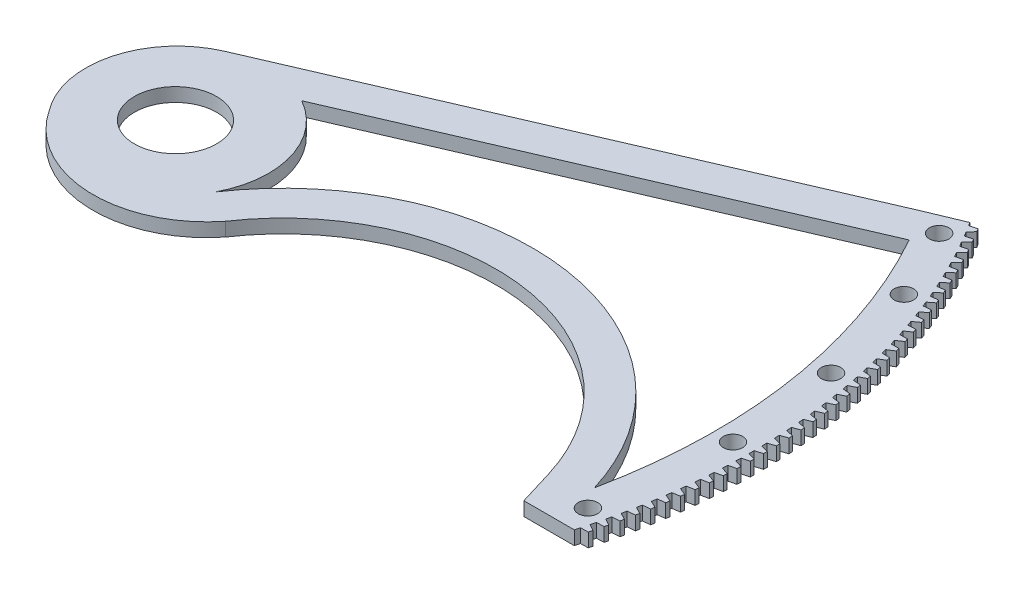
from build123d import *

# Parameters (mm, degrees)
SKETCH1_R                 = 3.3782
SKETCH1_R_2               = 14.28115
SKETCH1_R_3               = 2.5527
SKETCH1_R_4               = 9.5885
SKETCH1_R_5               = 19.177
SKETCH1_R_6               = 4.1275
BOSS_EXTRUDE1_DEPTH       = 4.7625
SKETCH2_R                 = 19.177
SKETCH2_R_2               = 2.5527
SKETCH2_R_3               = 4.1275
SKETCH2_R_4               = 9.5885
BOSS_EXTRUDE2_DEPTH       = 4.7625
CUT_EXTRUDE1_DEPTH        = 337.793278817
BOSS_EXTRUDE3_DEPTH       = 4.7625
BOSS_EXTRUDE4_DEPTH       = 4.7625
CUT_EXTRUDE3_DEPTH        = 262.784443921
BOSS_EXTRUDE6_START       = -4.7625
BOSS_EXTRUDE6_OUTLINE_R   = 3.3782
BOSS_EXTRUDE6_OUTLINE_R_2 = 2.5527
BOSS_EXTRUDE6_DEPTH       = 4.7625
SKETCH8_R                 = 3.3782
CUT_EXTRUDE4_DEPTH        = 4.7625


# Read off the part's stored shape, not the designer's step: Boss-Extrude6
with BuildPart() as part:
    # Sketch1 → Boss-Extrude1 (new body)
    with BuildSketch(Plane.XZ):
        with BuildLine():
            Line((231.775, 53.975), (-37.026544532, 53.975))
            ThreePointArc((-37.026544532, 53.975), (-39.086756581, 53.631498674), (-40.924075536, 52.638157895))
            ThreePointArc((-40.924075536, 52.638157895), (-66.304119268, -7.022776738), (-28.989130435, -60.043200628))
            ThreePointArc((-28.989130435, -60.043200628), (-26.371616333, -62.385880153), (-25.4, -65.761600688))
            Line((-25.4, -65.761600688), (-25.4, -230.990796624))
            ThreePointArc((-25.4, -230.990796624), (-23.721010495, -235.292442932), (-19.571917808, -237.3193116))
            ThreePointArc((-19.571917808, -237.3193116), (161.311736549, -175.162893549), (238.125, 0))
            Line((238.125, 0), (238.125, 47.625))
            ThreePointArc((238.125, 47.625), (236.265128061, 52.115128061), (231.775, 53.975))
        make_face()
        with Locations(Location((-60.325, 0, 0), (0, 0, 270))):
            Circle(SKETCH1_R, mode=Mode.SUBTRACT)
        with Locations(Location((-42.656216575, 42.656216575, 0), (0, 0, 270))):
            Circle(SKETCH1_R, mode=Mode.SUBTRACT)
        with Locations(Location((-42.656216575, -42.656216575, 0), (0, 0, 270))):
            Circle(SKETCH1_R, mode=Mode.SUBTRACT)
        with Locations(Location((0, -155.575, 0), (0, 0, 270))):
            Circle(SKETCH1_R, mode=Mode.SUBTRACT)
        with Locations(Location((0, -168.275, 0), (0, 0, 270))):
            Circle(SKETCH1_R, mode=Mode.SUBTRACT)
        with Locations(Location((0, -180.975, 0), (0, 0, 270))):
            Circle(SKETCH1_R, mode=Mode.SUBTRACT)
        with Locations(Location((0, -193.675, 0), (0, 0, 270))):
            Circle(SKETCH1_R, mode=Mode.SUBTRACT)
        with Locations(Location((0, -206.375, 0), (0, 0, 270))):
            Circle(SKETCH1_R, mode=Mode.SUBTRACT)
        with Locations(Location((0, -219.075, 0), (0, 0, 270))):
            Circle(SKETCH1_R, mode=Mode.SUBTRACT)
        with Locations(Location((59.53597499, -143.73255827, 0), (0, 0, 270))):
            Circle(SKETCH1_R, mode=Mode.SUBTRACT)
        with Locations(Location((64.396054581, -155.465828333, 0), (0, 0, 270))):
            Circle(SKETCH1_R, mode=Mode.SUBTRACT)
        with Locations(Location((69.256134172, -167.199098396, 0), (0, 0, 270))):
            Circle(SKETCH1_R, mode=Mode.SUBTRACT)
        with Locations(Location((74.116213763, -178.932368459, 0), (0, 0, 270))):
            Circle(SKETCH1_R, mode=Mode.SUBTRACT)
        with Locations(Location((78.976293354, -190.665638522, 0), (0, 0, 270))):
            Circle(SKETCH1_R, mode=Mode.SUBTRACT)
        with Locations(Location((83.836372945, -202.398908585, 0), (0, 0, 270))):
            Circle(SKETCH1_R, mode=Mode.SUBTRACT)
        with Locations(Location((110.008137483, -110.008137483, 0), (0, 0, 270))):
            Circle(SKETCH1_R, mode=Mode.SUBTRACT)
        with Locations(Location((118.988393604, -118.988393604, 0), (0, 0, 270))):
            Circle(SKETCH1_R, mode=Mode.SUBTRACT)
        with Locations(Location((127.968649725, -127.968649725, 0), (0, 0, 270))):
            Circle(SKETCH1_R, mode=Mode.SUBTRACT)
        with Locations(Location((136.948905846, -136.948905846, 0), (0, 0, 270))):
            Circle(SKETCH1_R, mode=Mode.SUBTRACT)
        with Locations(Location((145.929161967, -145.929161967, 0), (0, 0, 270))):
            Circle(SKETCH1_R, mode=Mode.SUBTRACT)
        with Locations(Location((154.909418088, -154.909418088, 0), (0, 0, 270))):
            Circle(SKETCH1_R, mode=Mode.SUBTRACT)
        with Locations(Location((143.73255827, -59.53597499, 0), (0, 0, 270))):
            Circle(SKETCH1_R, mode=Mode.SUBTRACT)
        with Locations(Location((155.465828333, -64.396054581, 0), (0, 0, 270))):
            Circle(SKETCH1_R, mode=Mode.SUBTRACT)
        with Locations(Location((167.199098396, -69.256134172, 0), (0, 0, 270))):
            Circle(SKETCH1_R, mode=Mode.SUBTRACT)
        with Locations(Location((178.932368459, -74.116213763, 0), (0, 0, 270))):
            Circle(SKETCH1_R, mode=Mode.SUBTRACT)
        with Locations(Location((190.665638522, -78.976293354, 0), (0, 0, 270))):
            Circle(SKETCH1_R, mode=Mode.SUBTRACT)
        with Locations(Location((202.398908585, -83.836372945, 0), (0, 0, 270))):
            Circle(SKETCH1_R, mode=Mode.SUBTRACT)
        with Locations(Location((155.575, 0, 0), (0, 0, 270))):
            Circle(SKETCH1_R, mode=Mode.SUBTRACT)
        with Locations(Location((168.275, 0, 0), (0, 0, 270))):
            Circle(SKETCH1_R, mode=Mode.SUBTRACT)
        with Locations(Location((180.975, 0, 0), (0, 0, 270))):
            Circle(SKETCH1_R, mode=Mode.SUBTRACT)
        with Locations(Location((193.675, 0, 0), (0, 0, 270))):
            Circle(SKETCH1_R, mode=Mode.SUBTRACT)
        with Locations(Location((206.375, 0, 0), (0, 0, 270))):
            Circle(SKETCH1_R, mode=Mode.SUBTRACT)
        with Locations(Location((219.075, 0, 0), (0, 0, 270))):
            Circle(SKETCH1_R, mode=Mode.SUBTRACT)
        with Locations(Location((0, 0, 0), (0, 0, 270))):
            Circle(SKETCH1_R_2, mode=Mode.SUBTRACT)
        with Locations(Location((148.683592319, 12.7, 0), (0, 0, 270))):
            Circle(SKETCH1_R, mode=Mode.SUBTRACT)
        with Locations(Location((141.086323741, -159.046835983, 0), (0, 0, 270))):
            Circle(SKETCH1_R, mode=Mode.SUBTRACT)
        with Locations(Location((150.036456986, -132.075944743, 0), (0, 0, 270))):
            Circle(SKETCH1_R, mode=Mode.SUBTRACT)
        with Locations(Location((150.066579862, -168.027092104, 0), (0, 0, 270))):
            Circle(SKETCH1_R, mode=Mode.SUBTRACT)
        with Locations(Location((159.016713107, -141.056200864, 0), (0, 0, 270))):
            Circle(SKETCH1_R, mode=Mode.SUBTRACT)
        with Locations(Location((-12.7, -186.8261925, 0), (0, 0, 270))):
            Circle(SKETCH1_R, mode=Mode.SUBTRACT)
        with Locations(Location((12.7, -174.083592319, 0), (0, 0, 270))):
            Circle(SKETCH1_R, mode=Mode.SUBTRACT)
        with Locations(Location((-12.7, -199.5261925, 0), (0, 0, 270))):
            Circle(SKETCH1_R, mode=Mode.SUBTRACT)
        with Locations(Location((12.7, -186.783592319, 0), (0, 0, 270))):
            Circle(SKETCH1_R, mode=Mode.SUBTRACT)
        with Locations(Location((-12.7, -212.2261925, 0), (0, 0, 270))):
            Circle(SKETCH1_R, mode=Mode.SUBTRACT)
        with Locations(Location((12.7, -199.483592319, 0), (0, 0, 270))):
            Circle(SKETCH1_R, mode=Mode.SUBTRACT)
        with Locations(Location((-12.7, -224.9261925, 0), (0, 0, 270))):
            Circle(SKETCH1_R, mode=Mode.SUBTRACT)
        with Locations(Location((12.7, -212.183592319, 0), (0, 0, 270))):
            Circle(SKETCH1_R, mode=Mode.SUBTRACT)
        with Locations(Location((69.482177721, -200.931515104, 0), (0, 0, 270))):
            Circle(SKETCH1_R, mode=Mode.SUBTRACT)
        with Locations(Location((88.072335872, -179.438728425, 0), (0, 0, 270))):
            Circle(SKETCH1_R, mode=Mode.SUBTRACT)
        with Locations(Location((74.342257312, -212.664785167, 0), (0, 0, 270))):
            Circle(SKETCH1_R, mode=Mode.SUBTRACT)
        with Locations(Location((92.932415463, -191.171998488, 0), (0, 0, 270))):
            Circle(SKETCH1_R, mode=Mode.SUBTRACT)
        with Locations(Location((50.041859357, -153.998434853, 0), (0, 0, 270))):
            Circle(SKETCH1_R, mode=Mode.SUBTRACT)
        with Locations(Location((68.632017508, -132.505648173, 0), (0, 0, 270))):
            Circle(SKETCH1_R, mode=Mode.SUBTRACT)
        with Locations(Location((54.901938948, -165.731704916, 0), (0, 0, 270))):
            Circle(SKETCH1_R, mode=Mode.SUBTRACT)
        with Locations(Location((73.492097099, -144.238918236, 0), (0, 0, 270))):
            Circle(SKETCH1_R, mode=Mode.SUBTRACT)
        with Locations(Location((59.762018539, -177.464974979, 0), (0, 0, 270))):
            Circle(SKETCH1_R, mode=Mode.SUBTRACT)
        with Locations(Location((78.35217669, -155.972188299, 0), (0, 0, 270))):
            Circle(SKETCH1_R, mode=Mode.SUBTRACT)
        with Locations(Location((64.62209813, -189.198245042, 0), (0, 0, 270))):
            Circle(SKETCH1_R, mode=Mode.SUBTRACT)
        with Locations(Location((83.212256281, -167.705458362, 0), (0, 0, 270))):
            Circle(SKETCH1_R, mode=Mode.SUBTRACT)
        with Locations(Location((123.125811499, -141.086323741, 0), (0, 0, 270))):
            Circle(SKETCH1_R, mode=Mode.SUBTRACT)
        with Locations(Location((132.075944743, -114.115432501, 0), (0, 0, 270))):
            Circle(SKETCH1_R, mode=Mode.SUBTRACT)
        with Locations(Location((132.10606762, -150.066579862, 0), (0, 0, 270))):
            Circle(SKETCH1_R, mode=Mode.SUBTRACT)
        with Locations(Location((141.056200864, -123.095688622, 0), (0, 0, 270))):
            Circle(SKETCH1_R, mode=Mode.SUBTRACT)
        with Locations(Location((200.89215767, -69.465875337, 0), (0, 0, 270))):
            Circle(SKETCH1_R, mode=Mode.SUBTRACT)
        with Locations(Location((202.944625985, -97.808797438, 0), (0, 0, 270))):
            Circle(SKETCH1_R, mode=Mode.SUBTRACT)
        with Locations(Location((189.158887607, -64.605795746, 0), (0, 0, 270))):
            Circle(SKETCH1_R, mode=Mode.SUBTRACT)
        with Locations(Location((191.211355922, -92.948717847, 0), (0, 0, 270))):
            Circle(SKETCH1_R, mode=Mode.SUBTRACT)
        with Locations(Location((105.165299257, -123.125811499, 0), (0, 0, 270))):
            Circle(SKETCH1_R, mode=Mode.SUBTRACT)
        with Locations(Location((114.115432501, -96.154920259, 0), (0, 0, 270))):
            Circle(SKETCH1_R, mode=Mode.SUBTRACT)
        with Locations(Location((114.145555378, -132.10606762, 0), (0, 0, 270))):
            Circle(SKETCH1_R, mode=Mode.SUBTRACT)
        with Locations(Location((123.095688622, -105.13517638, 0), (0, 0, 270))):
            Circle(SKETCH1_R, mode=Mode.SUBTRACT)
        with Locations(Location((153.959077418, -50.025556973, 0), (0, 0, 270))):
            Circle(SKETCH1_R, mode=Mode.SUBTRACT)
        with Locations(Location((156.011545734, -78.368479073, 0), (0, 0, 270))):
            Circle(SKETCH1_R, mode=Mode.SUBTRACT)
        with Locations(Location((142.225807355, -45.165477382, 0), (0, 0, 270))):
            Circle(SKETCH1_R, mode=Mode.SUBTRACT)
        with Locations(Location((144.278275671, -73.508399482, 0), (0, 0, 270))):
            Circle(SKETCH1_R, mode=Mode.SUBTRACT)
        with Locations(Location((177.425617544, -59.745716155, 0), (0, 0, 270))):
            Circle(SKETCH1_R, mode=Mode.SUBTRACT)
        with Locations(Location((179.478085859, -88.088638255, 0), (0, 0, 270))):
            Circle(SKETCH1_R, mode=Mode.SUBTRACT)
        with Locations(Location((165.692347481, -54.885636564, 0), (0, 0, 270))):
            Circle(SKETCH1_R, mode=Mode.SUBTRACT)
        with Locations(Location((167.744815797, -83.228558664, 0), (0, 0, 270))):
            Circle(SKETCH1_R, mode=Mode.SUBTRACT)
        with Locations(Location((-12.7, -161.4261925, 0), (0, 0, 270))):
            Circle(SKETCH1_R, mode=Mode.SUBTRACT)
        with Locations(Location((12.7, -148.683592319, 0), (0, 0, 270))):
            Circle(SKETCH1_R, mode=Mode.SUBTRACT)
        with Locations(Location((-12.7, -174.1261925, 0), (0, 0, 270))):
            Circle(SKETCH1_R, mode=Mode.SUBTRACT)
        with Locations(Location((12.7, -161.383592319, 0), (0, 0, 270))):
            Circle(SKETCH1_R, mode=Mode.SUBTRACT)
        with Locations(Location((186.8261925, -12.7, 0), (0, 0, 270))):
            Circle(SKETCH1_R, mode=Mode.SUBTRACT)
        with Locations(Location((174.083592319, 12.7, 0), (0, 0, 270))):
            Circle(SKETCH1_R, mode=Mode.SUBTRACT)
        with Locations(Location((199.5261925, -12.7, 0), (0, 0, 270))):
            Circle(SKETCH1_R, mode=Mode.SUBTRACT)
        with Locations(Location((186.783592319, 12.7, 0), (0, 0, 270))):
            Circle(SKETCH1_R, mode=Mode.SUBTRACT)
        with Locations(Location((212.2261925, -12.7, 0), (0, 0, 270))):
            Circle(SKETCH1_R, mode=Mode.SUBTRACT)
        with Locations(Location((199.483592319, 12.7, 0), (0, 0, 270))):
            Circle(SKETCH1_R, mode=Mode.SUBTRACT)
        with Locations(Location((224.9261925, -12.7, 0), (0, 0, 270))):
            Circle(SKETCH1_R, mode=Mode.SUBTRACT)
        with Locations(Location((212.183592319, 12.7, 0), (0, 0, 270))):
            Circle(SKETCH1_R, mode=Mode.SUBTRACT)
        with Locations(Location((161.4261925, -12.7, 0), (0, 0, 270))):
            Circle(SKETCH1_R, mode=Mode.SUBTRACT)
        with Locations(Location((174.1261925, -12.7, 0), (0, 0, 270))):
            Circle(SKETCH1_R, mode=Mode.SUBTRACT)
        with Locations(Location((161.383592319, 12.7, 0), (0, 0, 270))):
            Circle(SKETCH1_R, mode=Mode.SUBTRACT)
        with Locations(Location((225.425, 41.275, 0), (0, 0, 270))):
            Circle(SKETCH1_R_3, mode=Mode.SUBTRACT)
        with Locations(Location((212.725, 41.275, 0), (0, 0, 270))):
            Circle(SKETCH1_R_3, mode=Mode.SUBTRACT)
        with Locations(Location((200.025, 41.275, 0), (0, 0, 270))):
            Circle(SKETCH1_R_3, mode=Mode.SUBTRACT)
        with Locations(Location((187.325, 41.275, 0), (0, 0, 270))):
            Circle(SKETCH1_R_3, mode=Mode.SUBTRACT)
        with Locations(Location((174.625, 41.275, 0), (0, 0, 270))):
            Circle(SKETCH1_R_3, mode=Mode.SUBTRACT)
        with Locations(Location((161.925, 41.275, 0), (0, 0, 270))):
            Circle(SKETCH1_R_3, mode=Mode.SUBTRACT)
        with Locations(Location((149.225, 41.275, 0), (0, 0, 270))):
            Circle(SKETCH1_R_3, mode=Mode.SUBTRACT)
        with Locations(Location((136.525, 41.275, 0), (0, 0, 270))):
            Circle(SKETCH1_R_3, mode=Mode.SUBTRACT)
        with Locations(Location((123.825, 41.275, 0), (0, 0, 270))):
            Circle(SKETCH1_R_3, mode=Mode.SUBTRACT)
        with Locations(Location((111.125, 41.275, 0), (0, 0, 270))):
            Circle(SKETCH1_R_3, mode=Mode.SUBTRACT)
        with Locations(Location((98.425, 41.275, 0), (0, 0, 270))):
            Circle(SKETCH1_R_3, mode=Mode.SUBTRACT)
        with Locations(Location((73.025, 41.275, 0), (0, 0, 270))):
            Circle(SKETCH1_R_3, mode=Mode.SUBTRACT)
        with Locations(Location((85.725, 41.275, 0), (0, 0, 270))):
            Circle(SKETCH1_R_3, mode=Mode.SUBTRACT)
        with Locations(Location((60.325, 41.275, 0), (0, 0, 270))):
            Circle(SKETCH1_R_3, mode=Mode.SUBTRACT)
        with Locations(Location((47.625, 41.275, 0), (0, 0, 270))):
            Circle(SKETCH1_R_3, mode=Mode.SUBTRACT)
        with Locations(Location((34.925, 41.275, 0), (0, 0, 270))):
            Circle(SKETCH1_R_3, mode=Mode.SUBTRACT)
        with Locations(Location((22.225, 41.275, 0), (0, 0, 270))):
            Circle(SKETCH1_R_3, mode=Mode.SUBTRACT)
        with Locations(Location((9.525, 41.275, 0), (0, 0, 270))):
            Circle(SKETCH1_R_3, mode=Mode.SUBTRACT)
        with Locations(Location((-3.175, 41.275, 0), (0, 0, 270))):
            Circle(SKETCH1_R_3, mode=Mode.SUBTRACT)
        with Locations(Location((-15.875, 41.275, 0), (0, 0, 270))):
            Circle(SKETCH1_R_3, mode=Mode.SUBTRACT)
        with Locations(Location((-17.960512242, 17.960512242, 0), (0, 0, 270))):
            Circle(SKETCH1_R_3, mode=Mode.SUBTRACT)
        with Locations(Location((-17.960512242, -17.960512242, 0), (0, 0, 270))):
            Circle(SKETCH1_R_3, mode=Mode.SUBTRACT)
        with Locations(Location((17.960512242, -17.960512242, 0), (0, 0, 270))):
            Circle(SKETCH1_R_3, mode=Mode.SUBTRACT)
        with Locations(Location((17.960512242, 17.960512242, 0), (0, 0, 270))):
            Circle(SKETCH1_R_3, mode=Mode.SUBTRACT)
        with Locations(Location((52.114561305, -6.35, 0), (0, 0, 270))):
            Circle(SKETCH1_R_4, mode=Mode.SUBTRACT)
        with Locations(Location((70.075073547, 11.610512242, 0), (0, 0, 270))):
            Circle(SKETCH1_R_3, mode=Mode.SUBTRACT)
        with Locations(Location((-17.960512242, -34.539487758, 0), (0, 0, 270))):
            Circle(SKETCH1_R_3, mode=Mode.SUBTRACT)
        with Locations(Location((17.960512242, -70.460512242, 0), (0, 0, 270))):
            Circle(SKETCH1_R_3, mode=Mode.SUBTRACT)
        with Locations(Location((70.075073547, -24.310512242, 0), (0, 0, 270))):
            Circle(SKETCH1_R_3, mode=Mode.SUBTRACT)
        with Locations(Location((34.154049063, -24.310512242, 0), (0, 0, 270))):
            Circle(SKETCH1_R_3, mode=Mode.SUBTRACT)
        with Locations(Location((34.154049063, 11.610512242, 0), (0, 0, 270))):
            Circle(SKETCH1_R_3, mode=Mode.SUBTRACT)
        with Locations(Location((0, -52.5, 0), (0, 0, 270))):
            Circle(SKETCH1_R_5, mode=Mode.SUBTRACT)
        with Locations(Location((-17.960512242, -70.460512242, 0), (0, 0, 270))):
            Circle(SKETCH1_R_6, mode=Mode.SUBTRACT)
        with Locations(Location((17.960512242, -34.539487758, 0), (0, 0, 270))):
            Circle(SKETCH1_R_6, mode=Mode.SUBTRACT)
    extrude(amount=-BOSS_EXTRUDE1_DEPTH)

    # Sketch2 → Boss-Extrude2 (add, through all)
    with BuildSketch(Plane(origin=(0, 4.7625, 0), x_dir=(1, 0, 0), z_dir=(0, 1, 0))):
        with Locations((0, 52.5)):
            Circle(SKETCH2_R)
        with Locations((17.960512242, 70.460512242)):
            Circle(SKETCH2_R_2)
        with Locations((17.960512242, 34.539487758)):
            Circle(SKETCH2_R_3)
        with Locations((-17.960512242, 34.539487758)):
            Circle(SKETCH2_R_2)
        with Locations((-17.960512242, 70.460512242)):
            Circle(SKETCH2_R_3)
        with Locations((34.154049063, -11.610512242)):
            Circle(SKETCH2_R_2)
        with Locations((52.114561305, 6.35)):
            Circle(SKETCH2_R_4)
        with Locations((34.154049063, 24.310512242)):
            Circle(SKETCH2_R_2)
        with Locations((70.075073547, 24.310512242)):
            Circle(SKETCH2_R_2)
        with Locations((70.075073547, -11.610512242)):
            Circle(SKETCH2_R_2)
        with Locations((17.960512242, -17.960512242)):
            Circle(SKETCH2_R_2)
        with Locations((-17.960512242, -17.960512242)):
            Circle(SKETCH2_R_2)
        with Locations((-17.960512242, 17.960512242)):
            Circle(SKETCH2_R_2)
        with Locations((17.960512242, 17.960512242)):
            Circle(SKETCH2_R_2)
    extrude(amount=-BOSS_EXTRUDE2_DEPTH)

    # Sketch3 → Cut-Extrude1 (cut, through all)
    with BuildSketch(Plane(origin=(0, 4.7625, 0), x_dir=(1, 0, 0), z_dir=(0, 1, 0))):
        with BuildLine():
            Line((-28.989130435, 60.043200628), (-28.989130435, 240.201050618))
            Line((-28.989130435, 240.201050618), (143.888334306, 240.201050618))
            Line((143.888334306, 240.201050618), (143.888334306, 195.6215824))
            ThreePointArc((143.888334306, 195.6215824), (221.363286109, 99.849646033), (241.876866839, -21.615678064))
            Line((241.876866839, -21.615678064), (241.876866839, -61.19292902))
            Line((241.876866839, -61.19292902), (235.004429082, -61.19292902))
            Line((235.004429082, -61.19292902), (190.335012364, -61.19292902))
            ThreePointArc((190.335012364, -61.19292902), (189.377153718, 64.095905821), (114.045160912, 164.21234048))
            Line((114.045160912, 164.21234048), (0, 66.675))
            ThreePointArc((0, 66.675), (-14.869015151, 64.995907667), (-28.989130435, 60.043200628))
        make_face()
    extrude(amount=-CUT_EXTRUDE1_DEPTH, mode=Mode.SUBTRACT)

    # Sketch4 → Boss-Extrude3 (add)
    with BuildSketch(Plane(origin=(0, 4.7625, 0), x_dir=(1, 0, 0), z_dir=(0, 1, 0))):
        with BuildLine():
            ThreePointArc((129.551637083, 152.277262986), (132.10606762, 150.066579862), (134.622781108, 147.81305186))
            ThreePointArc((134.622781108, 147.81305186), (129.873882393, 147.530917355), (129.551637083, 152.277262986))
        make_face()
        with BuildLine():
            ThreePointArc((199.283126373, 16.069444182), (196.154815035, 12.485409157), (199.712292742, 9.326929894))
            ThreePointArc((199.712292742, 9.326929894), (199.5261925, 12.7), (199.283126373, 16.069444182))
        make_face()
        with BuildLine():
            ThreePointArc((188.080248089, 67.807166083), (185.962005828, 63.513924813), (190.263971279, 61.413457212))
            ThreePointArc((190.263971279, 61.413457212), (189.199119873, 64.619536774), (188.080248089, 67.807166083))
        make_face()
        with BuildLine():
            ThreePointArc((177.964091575, 91.108581392), (176.445459584, 86.600211868), (180.94083811, 85.043545302))
            ThreePointArc((180.94083811, 85.043545302), (179.478085859, 88.088638255), (177.964091575, 91.108581392))
        make_face()
        with BuildLine():
            ThreePointArc((147.814812624, 134.6208478), (147.500764259, 129.843793844), (152.279076239, 129.549505723))
            ThreePointArc((152.279076239, 129.549505723), (150.068368289, 132.104036019), (147.814812624, 134.6208478))
        make_face()
        with BuildLine():
            ThreePointArc((199.712170735, -9.329541997), (196.11221776, -12.485363516), (199.282901438, -16.072233445))
            ThreePointArc((199.282901438, -16.072233445), (199.52602055, -12.702701167), (199.712170735, -9.329541997))
        make_face()
    extrude(amount=-BOSS_EXTRUDE3_DEPTH)

    # Sketch5 → Boss-Extrude4 (add)
    with BuildSketch(Plane(origin=(0, 4.7625, 0), x_dir=(1, 0, 0), z_dir=(0, 1, 0))):
        with BuildLine():
            Line((114.045160912, 164.21234048), (116.093680364, 165.88051333))
            Line((116.093680364, 165.88051333), (117.157180308, 165.131106777))
            Line((117.157180308, 165.131106777), (116.277191019, 162.6394981))
            ThreePointArc((116.277191019, 162.6394981), (115.16386112, 163.429729809), (114.045160912, 164.21234048))
        make_face()
        with BuildLine():
            Line((117.709553836, 161.605855183), (119.795073393, 163.227533565))
            Line((119.795073393, 163.227533565), (120.841449697, 162.454397781))
            Line((120.841449697, 162.454397781), (119.905645131, 159.983210867))
            ThreePointArc((119.905645131, 159.983210867), (118.810369659, 160.798282189), (117.709553836, 161.605855183))
        make_face()
        with BuildLine():
            Line((121.314398348, 158.917614653), (123.435862962, 160.491978173))
            Line((123.435862962, 160.491978173), (124.464586272, 159.69550428))
            Line((124.464586272, 159.69550428), (123.473439844, 157.245989286))
            ThreePointArc((123.473439844, 157.245989286), (122.396772893, 158.085487882), (121.314398348, 158.917614653))
        make_face()
        with BuildLine():
            Line((124.857870785, 156.148978852), (127.014207221, 157.675231052))
            Line((127.014207221, 157.675231052), (128.024757114, 156.855821981))
            Line((128.024757114, 156.855821981), (126.978770239, 154.429218097))
            ThreePointArc((126.978770239, 154.429218097), (125.921256485, 155.292719271), (124.857870785, 156.148978852))
        make_face()
        with BuildLine():
            Line((128.338178528, 153.301348414), (130.528295912, 154.778717172))
            Line((130.528295912, 154.778717172), (131.520161157, 153.936787456))
            Line((131.520161157, 153.936787456), (130.419862993, 151.534322285))
            ThreePointArc((130.419862993, 151.534322285), (129.382037425, 152.421389198), (128.338178528, 153.301348414))
        make_face()
        with BuildLine():
            Line((131.753560917, 150.376163933), (133.976351284, 151.80390186))
            Line((133.976351284, 151.80390186), (134.949030104, 150.939877425))
            Line((134.949030104, 150.939877425), (133.794977283, 148.562766356))
            ThreePointArc((133.794977283, 148.562766356), (132.77736493, 149.472950248), (131.753560917, 150.376163933))
        make_face()
        with BuildLine():
            Line((135.102290132, 147.37490524), (137.356628989, 148.752290053))
            Line((137.356628989, 148.752290053), (138.309629313, 147.866608003))
            Line((138.309629313, 147.866608003), (137.102405662, 145.5160536))
            ThreePointArc((137.102405662, 145.5160536), (136.105521326, 146.448894014), (135.102290132, 147.37490524))
        make_face()
        with BuildLine():
            Line((138.382672078, 144.299090649), (140.66741897, 145.625425539))
            Line((140.66741897, 145.625425539), (141.600258682, 144.718533935))
            Line((141.600258682, 144.718533935), (140.340474927, 142.395725325))
            ThreePointArc((140.340474927, 142.395725325), (139.364822925, 143.350750345), (138.382672078, 144.299090649))
        make_face()
        with BuildLine():
            Line((141.593047231, 141.150276193), (143.907046322, 142.424890177))
            Line((143.907046322, 142.424890177), (144.819253506, 141.497247808))
            Line((144.819253506, 141.497247808), (143.507546961, 139.203360084))
            ThreePointArc((143.507546961, 139.203360084), (142.553620869, 140.18008657), (141.593047231, 141.150276193))
        make_face()
        with BuildLine():
            Line((144.731791487, 137.930054834), (147.073872141, 139.152303094))
            Line((147.073872141, 139.152303094), (147.964985317, 138.204379248))
            Line((147.964985317, 138.204379248), (146.602019567, 135.940572871))
            ThreePointArc((146.602019567, 135.940572871), (145.670301968, 136.938506703), (144.731791487, 137.930054834))
        make_face()
        with BuildLine():
            Line((147.797316977, 134.640055659), (150.166294354, 135.809319869))
            Line((150.166294354, 135.809319869), (151.035862714, 134.841594093))
            Line((151.035862714, 134.841594093), (149.622327272, 132.609014306))
            ThreePointArc((149.622327272, 132.609014306), (148.713289516, 133.627650638), (147.797316977, 134.640055659))
        make_face()
        with BuildLine():
            Line((150.788072875, 131.281943054), (153.182748525, 132.397631692))
            Line((153.182748525, 132.397631692), (154.030332161, 131.410593551))
            Line((154.030332161, 131.410593551), (152.566942125, 129.210369801))
            ThreePointArc((152.566942125, 129.210369801), (151.681044087, 130.249193311), (150.788072875, 131.281943054))
        make_face()
        with BuildLine():
            Line((153.702546179, 127.857415865), (156.121708652, 128.918964511))
            Line((156.121708652, 128.918964511), (156.946878778, 127.913113342))
            Line((156.946878778, 127.913113342), (155.434374467, 125.746358706))
            ThreePointArc((155.434374467, 125.746358706), (154.572064316, 126.80484386), (153.702546179, 127.857415865))
        make_face()
        with BuildLine():
            Line((156.539262477, 124.368206535), (158.981687938, 125.37507816))
            Line((158.981687938, 125.37507816), (159.784027106, 124.350922815))
            Line((159.784027106, 124.350922815), (158.223173683, 122.218733437))
            ThreePointArc((158.223173683, 122.218733437), (157.384887658, 123.296344757), (156.539262477, 124.368206535))
        make_face()
        with BuildLine():
            Line((159.296786695, 120.81608023), (161.761239539, 121.767765464))
            Line((161.761239539, 121.767765464), (162.540341851, 120.725824056))
            Line((162.540341851, 120.725824056), (160.931928942, 118.629278597))
            ThreePointArc((160.931928942, 118.629278597), (160.118091124, 119.725470926), (159.296786695, 120.81608023))
        make_face()
        with BuildLine():
            Line((161.973723823, 117.202833944), (164.458957299, 118.098851337))
            Line((164.458957299, 118.098851337), (165.214428614, 117.039650977))
            Line((165.214428614, 117.039650977), (163.559269903, 114.979810063))
            ThreePointArc((163.559269903, 114.979810063), (162.770292006, 116.094028846), (161.973723823, 117.202833944))
        make_face()
        with BuildLine():
            Line((164.568719616, 113.530295593), (167.073476464, 114.370191857))
            Line((167.073476464, 114.370191857), (167.804934594, 113.294268386))
            Line((167.804934594, 113.294268386), (166.103867414, 111.272174076))
            ThreePointArc((166.103867414, 111.272174076), (165.340148577, 112.403855637), (164.568719616, 113.530295593))
        make_face()
        with BuildLine():
            Line((167.080461285, 109.800323088), (169.603474367, 110.583673324))
            Line((169.603474367, 110.583673324), (170.310549272, 109.491571045))
            Line((170.310549272, 109.491571045), (168.564434181, 107.508246301))
            ThreePointArc((168.564434181, 107.508246301), (167.826360763, 108.656818131), (167.080461285, 109.800323088))
        make_face()
        with BuildLine():
            Line((169.507678159, 106.014803394), (172.0476711, 106.741211312))
            Line((172.0476711, 106.741211312), (172.730005076, 105.63348271))
            Line((172.730005076, 105.63348271), (170.939725421, 103.689930884))
            ThreePointArc((170.939725421, 103.689930884), (170.227670809, 104.854811928), (169.507678159, 106.014803394))
        make_face()
        with BuildLine():
            Line((171.849142325, 102.175651579), (174.404830161, 102.844749694))
            Line((174.404830161, 102.844749694), (175.062078022, 101.721955162))
            Line((175.062078022, 101.721955162), (173.228539491, 99.81915948))
            ThreePointArc((173.228539491, 99.81915948), (172.542863908, 100.999760435), (171.849142325, 102.175651579))
        make_face()
        with BuildLine():
            Line((174.103669255, 98.284809841), (176.673759082, 98.896259661))
            Line((176.673759082, 98.896259661), (177.305588329, 97.758967212))
            Line((177.305588329, 97.758967212), (175.429718497, 95.897890287))
            ThreePointArc((175.429718497, 95.897890287), (174.770768822, 97.093613893), (174.103669255, 98.284809841))
        make_face()
        with BuildLine():
            Line((176.270118399, 94.344246529), (178.853310027, 94.897738727))
            Line((178.853310027, 94.897738727), (179.459401023, 93.74652371))
            Line((179.459401023, 93.74652371), (177.542148879, 91.928107045))
            ThreePointArc((177.542148879, 91.928107045), (176.910258469, 93.138348396), (176.270118399, 94.344246529))
        make_face()
        with BuildLine():
            Line((178.347393766, 90.355955147), (180.942380378, 90.851209714))
            Line((180.942380378, 90.851209714), (181.522426505, 89.686654519))
            Line((181.522426505, 89.686654519), (179.564761973, 87.91181804))
            ThreePointArc((179.564761973, 87.91181804), (178.960250497, 89.135964883), (178.347393766, 90.355955147))
        make_face()
        with BuildLine():
            Line((180.334444477, 86.32195334), (182.939913288, 86.758719731))
            Line((182.939913288, 86.758719731), (183.493621106, 85.581413499))
            Line((183.493621106, 85.581413499), (181.496534554, 83.851055082))
            ThreePointArc((181.496534554, 83.851055082), (180.91970783, 85.08848813), (180.334444477, 86.32195334))
        make_face()
        with BuildLine():
            Line((182.230265299, 82.244281883), (184.844898221, 82.62233914))
            Line((184.844898221, 82.62233914), (185.371987613, 81.432877462))
            Line((185.371987613, 81.432877462), (183.336489352, 79.747872482))
            ThreePointArc((183.336489352, 79.747872482), (182.787639193, 80.997965727), (182.230265299, 82.244281883))
        make_face()
        with BuildLine():
            Line((184.033897149, 78.125003638), (186.656371457, 78.444160506))
            Line((186.656371457, 78.444160506), (187.156575773, 77.243145121))
            Line((187.156575773, 77.243145121), (185.083695548, 75.604346011))
            ThreePointArc((185.083695548, 75.604346011), (184.563099612, 76.866467039), (184.033897149, 78.125003638))
        make_face()
        with BuildLine():
            Line((185.744427583, 73.96620252), (188.373416587, 74.226297539))
            Line((188.373416587, 74.226297539), (188.846482776, 73.014336033))
            Line((188.846482776, 73.014336033), (186.737269242, 71.422571849))
            ThreePointArc((186.737269242, 71.422571849), (186.245190895, 72.696082163), (185.744427583, 73.96620252))
        make_face()
        with BuildLine():
            Line((187.360991256, 69.769982436), (189.995164969, 69.970884026))
            Line((189.995164969, 69.970884026), (190.440853711, 68.748589521))
            Line((190.440853711, 68.748589521), (188.296373903, 67.204665525))
            ThreePointArc((188.296373903, 67.204665525), (187.833062085, 68.488920865), (187.360991256, 69.769982436))
        make_face()
        with BuildLine():
            Line((188.882770359, 65.538466223), (191.520796173, 65.680072749))
            Line((191.520796173, 65.680072749), (191.938881996, 64.448063595))
            Line((191.938881996, 64.448063595), (189.760220792, 62.952760847))
            ThreePointArc((189.760220792, 62.952760847), (189.325909889, 64.247111517), (188.882770359, 65.538466223))
        make_face()
        with BuildLine():
            Line((190.308995037, 61.273794574), (192.949538393, 61.356034399))
            Line((192.949538393, 61.356034399), (193.339809791, 60.11493386))
            Line((193.339809791, 60.11493386), (191.12806936, 58.669008823))
            ThreePointArc((191.12806936, 58.669008823), (190.722979085, 59.972800021), (190.308995037, 61.273794574))
        make_face()
        with BuildLine():
            Line((191.638943772, 56.978124956), (194.280668838, 57.000956475))
            Line((194.280668838, 57.000956475), (194.642928376, 55.751392416))
            Line((194.642928376, 55.751392416), (192.39922762, 54.355576573))
            ThreePointArc((192.39922762, 54.355576573), (192.023562907, 55.66814872), (191.638943772, 56.978124956))
        make_face()
        with BuildLine():
            Line((192.871943753, 52.653630517), (195.513514099, 52.61704218))
            Line((195.513514099, 52.61704218), (195.847578513, 51.359646745))
            Line((195.847578513, 51.359646745), (193.573052505, 50.01464623))
            ThreePointArc((193.573052505, 50.01464623), (193.227003399, 51.335335305), (192.871943753, 52.653630517))
        make_face()
        with BuildLine():
            Line((194.007371213, 48.302498987), (196.647450489, 48.206509304))
            Line((196.647450489, 48.206509304), (196.953150778, 46.941918601))
            Line((196.953150778, 46.941918601), (194.648950183, 45.648413839))
            ThreePointArc((194.648950183, 45.648413839), (194.332691749, 46.976551716), (194.007371213, 48.302498987))
        make_face()
        with BuildLine():
            Line((195.044651749, 43.926931573), (197.681904358, 43.771589104))
            Line((197.681904358, 43.771589104), (197.959085869, 42.500442881))
            Line((197.959085869, 42.500442881), (195.626376367, 41.259088246))
            ThreePointArc((195.626376367, 41.259088246), (195.340068597, 42.594003029), (195.044651749, 43.926931573))
        make_face()
        with BuildLine():
            Line((195.983260608, 39.529141843), (198.616352382, 39.314525174))
            Line((198.616352382, 39.314525174), (198.864874892, 38.037466494))
            Line((198.864874892, 38.037466494), (196.504836584, 36.848889979))
            ThreePointArc((196.504836584, 36.848889979), (196.248624318, 38.189906345), (195.983260608, 39.529141843))
        make_face()
        with BuildLine():
            Line((196.822722955, 35.111354605), (199.450321831, 34.837572311))
            Line((199.450321831, 34.837572311), (199.670059615, 33.555247228))
            Line((199.670059615, 33.555247228), (197.283886426, 32.420050126))
            ThreePointArc((197.283886426, 32.420050126), (197.057899282, 33.766489663), (196.822722955, 35.111354605))
        make_face()
        with BuildLine():
            Line((197.56261411, 30.675804788), (200.183390807, 30.342995372))
            Line((200.183390807, 30.342995372), (200.3742327, 29.056052605))
            Line((200.3742327, 29.056052605), (197.963131778, 27.974809204))
            ThreePointArc((197.963131778, 27.974809204), (197.76748408, 29.325990759), (197.56261411, 30.675804788))
        make_face()
        with BuildLine():
            Line((198.20255977, 26.224736303), (200.815188455, 25.833068131))
            Line((200.815188455, 25.833068131), (200.977037912, 24.542158736))
            Line((200.977037912, 24.542158736), (198.542229016, 23.515416028))
            ThreePointArc((198.542229016, 23.515416028), (198.377019741, 24.870656048), (198.20255977, 26.224736303))
        make_face()
        with BuildLine():
            Line((198.742236189, 21.760400914), (201.345395152, 21.310072128))
            Line((201.345395152, 21.310072128), (201.478170295, 20.015849167))
            Line((201.478170295, 20.015849167), (199.020885177, 19.044126574))
            ThreePointArc((199.020885177, 19.044126574), (198.886197903, 20.402739453), (198.742236189, 21.760400914))
        make_face()
        with BuildLine():
            Line((199.18137035, 17.285057096), (201.773742672, 16.776295514))
            Line((201.773742672, 16.776295514), (201.87737633, 15.479413724))
            Line((201.87737633, 15.479413724), (199.398858113, 14.563202834))
            ThreePointArc((199.398858113, 14.563202834), (199.294760978, 15.924501259), (199.18137035, 17.285057096))
        make_face()
        with BuildLine():
            Line((199.519740098, 12.800968892), (202.100014317, 12.234031893))
            Line((202.100014317, 12.234031893), (202.174454062, 10.935147358))
            Line((202.174454062, 10.935147358), (199.67595661, 10.074911675))
            ThreePointArc((199.67595661, 10.074911675), (199.602502276, 11.438206976), (199.519740098, 12.800968892))
        make_face()
        with BuildLine():
            Line((199.757174254, 8.310404771), (202.324045027, 7.685579164))
            Line((202.324045027, 7.685579164), (202.369253202, 6.38534898))
            Line((202.369253202, 6.38534898), (199.852040487, 5.581523691))
            ThreePointArc((199.852040487, 5.581523691), (199.809266113, 6.946126186), (199.757174254, 8.310404771))
        make_face()
        with BuildLine():
            Line((199.893552702, 3.815636476), (202.445721468, 3.133238357))
            Line((202.445721468, 3.133238357), (202.461675202, 1.8323203))
            Line((202.461675202, 1.8323203), (199.927020663, 1.085312055))
            ThreePointArc((199.927020663, 1.085312055), (199.914947889, 2.450531402), (199.893552702, 3.815636476))
        make_face()
        with BuildLine():
            Line((199.928806448, -0.681062122), (202.464982084, -1.420687534))
            Line((202.464982084, -1.420687534), (202.451673306, -2.721635337))
            Line((202.451673306, -2.721635337), (199.900859207, -3.411448633))
            ThreePointArc((199.900859207, -3.411448633), (199.91949414, -2.046303089), (199.928806448, -0.681062122))
        make_face()
        with BuildLine():
            Line((199.862917659, -5.177416175), (202.381817131, -5.973894708))
            Line((202.381817131, -5.973894708), (202.339252574, -7.274214119))
            Line((202.339252574, -7.274214119), (199.773569354, -7.906483494))
            ThreePointArc((199.773569354, -7.906483494), (199.822902566, -6.54210237), (199.862917659, -5.177416175))
        make_face()
        with BuildLine():
            Line((199.695919667, -9.671151011), (202.196268682, -10.524079733))
            Line((202.196268682, -10.524079733), (202.124469879, -11.823112928))
            Line((202.124469879, -11.823112928), (199.545215498, -12.397518521))
            ThreePointArc((199.545215498, -12.397518521), (199.625222033, -11.034592048), (199.695919667, -9.671151011))
        make_face()
        with BuildLine():
            Line((199.427896955, -14.159993281), (201.908430605, -15.068940702))
            Line((201.908430605, -15.068940702), (201.807433878, -16.366030511))
            Line((201.807433878, -16.366030511), (199.215913162, -16.882281734))
            ThreePointArc((199.215913162, -16.882281734), (199.326552545, -15.521499406), (199.427896955, -14.159993281))
        make_face()
        with BuildLine():
            Line((199.058985113, -18.641672114), (201.518448514, -19.606178403))
            Line((201.518448514, -19.606178403), (201.388304958, -20.900668637))
            Line((201.388304958, -20.900668637), (198.785828938, -21.358504323))
            ThreePointArc((198.785828938, -21.358504323), (198.927045198, -20.00055455), (199.058985113, -18.641672114))
        make_face()
        with BuildLine():
            Line((198.589370772, -23.113920259), (201.0265197, -24.13349748))
            Line((201.0265197, -24.13349748), (200.867295152, -25.424733266))
            Line((200.867295152, -25.424733266), (198.255180402, -25.823921799))
            ThreePointArc((198.255180402, -25.823921799), (198.426902098, -24.469491559), (198.589370772, -23.113920259))
        make_face()
        with BuildLine():
            Line((198.019291506, -27.57447524), (200.432893024, -28.648607595))
            Line((200.432893024, -28.648607595), (200.244668035, -29.935935706))
            Line((200.244668035, -29.935935706), (197.624236006, -30.27627514))
            ThreePointArc((197.624236006, -30.27627514), (197.826376266, -28.926049628), (198.019291506, -27.57447524))
        make_face()
        with BuildLine():
            Line((197.349035715, -32.021080493), (199.737868799, -33.149224588))
            Line((199.737868799, -33.149224588), (199.520738591, -34.431993773))
            Line((199.520738591, -34.431993773), (196.89331494, -34.713311933))
            ThreePointArc((196.89331494, -34.713311933), (197.125771501, -33.367974219), (197.349035715, -32.021080493))
        make_face()
        with BuildLine():
            Line((196.578942475, -36.451486514), (198.941798632, -37.633071627))
            Line((198.941798632, -37.633071627), (198.69587305, -38.910632944))
            Line((198.69587305, -38.910632944), (196.062786971, -39.132787513))
            ThreePointArc((196.062786971, -39.132787513), (196.325442236, -37.793018193), (196.578942475, -36.451486514))
        make_face()
        with BuildLine():
            Line((195.709401371, -40.863451991), (198.04508525, -42.097880368))
            Line((198.04508525, -42.097880368), (197.770488705, -43.369587508))
            Line((197.770488705, -43.369587508), (195.133072258, -43.532466098))
            ThreePointArc((195.133072258, -43.532466098), (195.425793352, -42.198942953), (195.709401371, -40.863451991))
        make_face()
        with BuildLine():
            Line((194.740852297, -45.254744944), (197.048182293, -46.541392097))
            Line((197.048182293, -46.541392097), (196.745053702, -47.806601711))
            Line((196.745053702, -47.806601711), (194.104641136, -47.910121924))
            ThreePointArc((194.104641136, -47.910121924), (194.427279973, -46.583519573), (194.740852297, -45.254744944))
        make_face()
        with BuildLine():
            Line((193.673785237, -49.623143849), (195.951594087, -50.961358871))
            Line((195.951594087, -50.961358871), (195.6200868, -52.2194309))
            Line((195.6200868, -52.2194309), (192.978013882, -52.263540367))
            ThreePointArc((192.978013882, -52.263540367), (193.330407241, -50.944529928), (193.673785237, -49.623143849))
        make_face()
    extrude(amount=-BOSS_EXTRUDE4_DEPTH)

    # Sketch6 → Cut-Extrude3 (cut, through all)
    with BuildSketch(Plane(origin=(0, 4.7625, 0), x_dir=(1, 0, 0), z_dir=(0, 1, 0))):
        with BuildLine():
            Line((175.005697245, -53.975), (-85.588141887, -53.975))
            Line((-85.588141887, -53.975), (-85.588141887, 59.184152048))
            Line((-85.588141887, 59.184152048), (64.405913596, 138.096857003))
            Line((64.405913596, 138.096857003), (114.045160912, 177.505984893))
            Line((114.045160912, 177.505984893), (144.044928675, 179.631230449))
            Line((144.044928675, 179.631230449), (180.137734456, 111.913914964))
            Line((180.137734456, 111.913914964), (156.905936983, 102.264374671))
            Line((156.905936983, 102.264374671), (-12.130351677, 29.301391568))
            ThreePointArc((-12.130351677, 29.301391568), (-30.274585055, 8.140499351), (-24.730388277, -19.177232005))
            ThreePointArc((-24.730388277, -19.177232005), (6.512040293, -36.698329354), (39.063701541, -21.749498456))
            ThreePointArc((39.063701541, -21.749498456), (111.395067317, 10.083410171), (171.222693693, -41.54812737))
            Line((171.222693693, -41.54812737), (175.005697245, -53.975))
        make_face()
        with BuildLine():
            Line((163.481550999, 91.399233148), (16.092042368, 27.779886598))
            ThreePointArc((16.092042368, 27.779886598), (30.914420958, 9.085364195), (28.531393775, -14.652985713))
            ThreePointArc((28.531393775, -14.652985713), (113.276646982, 22.643253242), (183.372203614, -37.849558908))
            ThreePointArc((183.372203614, -37.849558908), (185.104609877, 28.571973621), (163.481550999, 91.399233148))
        make_face()
    extrude(amount=-CUT_EXTRUDE3_DEPTH, mode=Mode.SUBTRACT)

    # Boss-Extrude6 outline → Boss-Extrude6 (add)
    with BuildSketch(Plane(origin=(0, 4.7625, 0), x_dir=(1, 0, 0), z_dir=(0, 1, 0)).offset(BOSS_EXTRUDE6_START)):
        with BuildLine():
            ThreePointArc((166.253430061, 86.259730686), (167.78325254, 83.247645306), (169.258361107, 80.208390485))
            ThreePointArc((169.258361107, 80.208390485), (170.770506184, 84.731034262), (166.253430061, 86.259730686))
        make_face()
        with BuildLine():
            ThreePointArc((176.403553461, 62.965595074), (177.510360983, 59.774250919), (178.55929087, 56.563418239))
            ThreePointArc((178.55929087, 56.563418239), (180.627192346, 60.823748635), (176.403553461, 62.965595074))
        make_face()
        with BuildLine():
            ThreePointArc((186.599272048, 16.070570033), (186.856626218, 12.702048541), (187.053029109, 9.329424323))
            ThreePointArc((187.053029109, 9.329424323), (190.196765355, 12.92687853), (186.599272048, 16.070570033))
        make_face()
        with BuildLine():
            ThreePointArc((187.037455389, -9.331352084), (186.835428068, -12.703576049), (186.572458848, -16.071595749))
            ThreePointArc((186.572458848, -16.071595749), (190.153781872, -12.932502942), (187.037455389, -9.331352084))
        make_face()
        with BuildLine():
            ThreePointArc((173.195267389, -15.959311899), (171.98233991, -14.137842547), (170.723826559, -12.347566642))
            ThreePointArc((170.723826559, -12.347566642), (171.295628083, -14.607744914), (173.195267389, -15.959311899))
        make_face()
        with BuildLine():
            ThreePointArc((156.144501435, 3.32985035), (153.351989375, -2.543709693), (158.798556089, 1.010406542))
            ThreePointArc((158.798556089, 1.010406542), (157.483317169, 2.183617489), (156.144501435, 3.32985035))
        make_face()
        with Locations((161.383592319, -12.7)):
            Circle(BOSS_EXTRUDE6_OUTLINE_R)
        with Locations((187.325, -41.275)):
            Circle(BOSS_EXTRUDE6_OUTLINE_R_2)
        with Locations((174.625, -41.275)):
            Circle(BOSS_EXTRUDE6_OUTLINE_R_2)
    extrude(amount=BOSS_EXTRUDE6_DEPTH)

    # Sketch8 → Cut-Extrude4 (cut)
    with BuildSketch(Plane(origin=(0, 4.7625, 0), x_dir=(1, 0, 0), z_dir=(0, 1, 0))):
        with Locations(Location((188.357482972, -45.071767588, 0), (0, 0, 270))):
            Circle(SKETCH8_R)
        with Locations(Location((189.953589182, 37.784118116, 0), (0, 0, 270))):
            Circle(SKETCH8_R)
        with Locations(Location((166.703982348, 98.58898465, 0), (0, 0, 270))):
            Circle(SKETCH8_R)
    extrude(amount=-CUT_EXTRUDE4_DEPTH, mode=Mode.SUBTRACT)


solid = part.part
